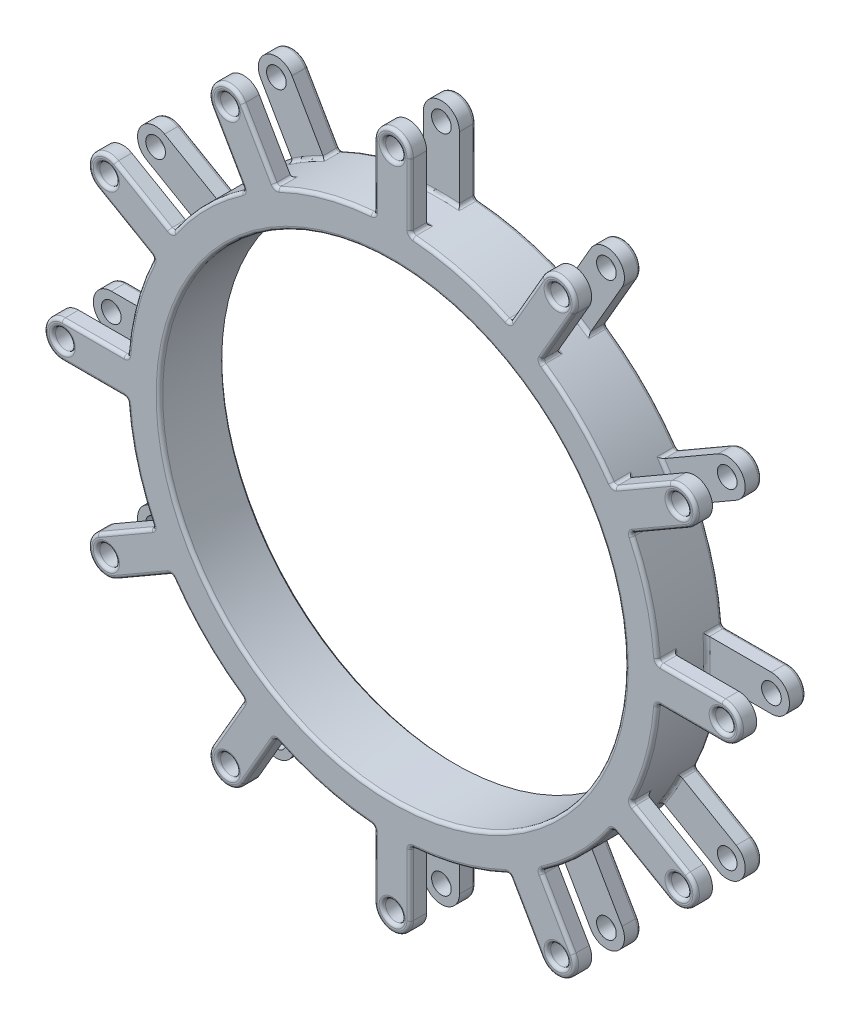
from build123d import *

# Parameters (mm, degrees)
ESQUISSE1_R                             = 40.5
ESQUISSE1_R_2                           = 35.5
BOSS_EXTRU_1_DEPTH                      = 10
ESQUISSE2_R                             = 1.5
BOSS_EXTRU_2_DEPTH                      = 2.5
CHANFREIN1_SIZE                         = 0.5
R_P_TITION_CIRCULAIRE2_COUNT            = 12
R_P_TITION_CIRCULAIRE2_COPY_1_SKETCH_R  = 1.5
R_P_TITION_CIRCULAIRE2_COPY_1_DEPTH     = 2.5
R_P_TITION_CIRCULAIRE2_COPY_2_SKETCH_R  = 1.5
R_P_TITION_CIRCULAIRE2_COPY_2_DEPTH     = 2.5
R_P_TITION_CIRCULAIRE2_COPY_3_SKETCH_R  = 1.5
R_P_TITION_CIRCULAIRE2_COPY_3_DEPTH     = 2.5
R_P_TITION_CIRCULAIRE2_COPY_4_SKETCH_R  = 1.5
R_P_TITION_CIRCULAIRE2_COPY_4_DEPTH     = 2.5
R_P_TITION_CIRCULAIRE2_COPY_5_SKETCH_R  = 1.5
R_P_TITION_CIRCULAIRE2_COPY_5_DEPTH     = 2.5
R_P_TITION_CIRCULAIRE2_COPY_6_SKETCH_R  = 1.5
R_P_TITION_CIRCULAIRE2_COPY_6_DEPTH     = 2.5
R_P_TITION_CIRCULAIRE2_COPY_7_SKETCH_R  = 1.5
R_P_TITION_CIRCULAIRE2_COPY_7_DEPTH     = 2.5
R_P_TITION_CIRCULAIRE2_COPY_8_SKETCH_R  = 1.5
R_P_TITION_CIRCULAIRE2_COPY_8_DEPTH     = 2.5
R_P_TITION_CIRCULAIRE2_COPY_9_SKETCH_R  = 1.5
R_P_TITION_CIRCULAIRE2_COPY_9_DEPTH     = 2.5
R_P_TITION_CIRCULAIRE2_COPY_10_SKETCH_R = 1.5
R_P_TITION_CIRCULAIRE2_COPY_10_DEPTH    = 2.5
R_P_TITION_CIRCULAIRE2_COPY_11_SKETCH_R = 1.5
R_P_TITION_CIRCULAIRE2_COPY_11_DEPTH    = 2.5
CONG_2_R                                = 0.5


with BuildPart() as part:
    # Esquisse1 → Boss.-Extru.1 (new body)
    with BuildSketch(Plane.XY):
        Circle(ESQUISSE1_R)
        Circle(ESQUISSE1_R_2, mode=Mode.SUBTRACT)
    extrude(amount=BOSS_EXTRU_1_DEPTH)

    # Esquisse2 → Boss.-Extru.2 (add)
    with BuildSketch(Plane(origin=(0, 0, 0), x_dir=(-1, 0, 0), z_dir=(0, 0, -1))):
        with BuildLine():
            ThreePointArc((-40.406527938, -2.75), (-40.5, 0), (-40.406527938, 2.75))
            Line((-40.406527938, 2.75), (-50.325274426, 2.75))
            ThreePointArc((-50.325274426, 2.75), (-53.075274426, 0), (-50.325274426, -2.75))
            Line((-50.325274426, -2.75), (-40.406527938, -2.75))
        make_face()
        with Locations((-50.325274426, 0)):
            Circle(ESQUISSE2_R, mode=Mode.SUBTRACT)
    boss_extru_2 = extrude(amount=-BOSS_EXTRU_2_DEPTH)

    # Symétrie1: Boss.-Extru.2 across plane
    add(boss_extru_2.mirror(Plane(origin=(0, 0, 5), x_dir=(1, 0, 0), z_dir=(0, 0, -1))))

    # Chanfrein1
    chanfrein1_edges = [part.edges().sort_by_distance(p)[0] for p in [
        (-35.5, 0, 0),
    ]]
    chamfer(chanfrein1_edges, length=CHANFREIN1_SIZE)

    # Répétition circulaire2: Boss.-Extru.2 ×12 about axis
    r_p_tition_circulaire2_axis = Axis((0, 0, 0), (0, 0, 1))
    for i in range(1, R_P_TITION_CIRCULAIRE2_COUNT):
        add(boss_extru_2.rotate(r_p_tition_circulaire2_axis, i * 360 / R_P_TITION_CIRCULAIRE2_COUNT))

    # Répétition circulaire2 copy 1 sketch → Répétition circulaire2 copy 1 (add)
    with BuildSketch(Plane(origin=(0, 0, 10), x_dir=(-0.8660254037844387, -0.49999999999999994, 0), z_dir=(0, 0, 1))):
        with BuildLine():
            ThreePointArc((-40.406527938, 2.75), (-40.5, 0), (-40.406527938, -2.75))
            Line((-40.406527938, -2.75), (-50.325274426, -2.75))
            ThreePointArc((-50.325274426, -2.75), (-53.075274426, 0), (-50.325274426, 2.75))
            Line((-50.325274426, 2.75), (-40.406527938, 2.75))
        make_face()
        with Locations((-50.325274426, 0)):
            Circle(R_P_TITION_CIRCULAIRE2_COPY_1_SKETCH_R, mode=Mode.SUBTRACT)
    extrude(amount=-R_P_TITION_CIRCULAIRE2_COPY_1_DEPTH)

    # Répétition circulaire2 copy 2 sketch → Répétition circulaire2 copy 2 (add)
    with BuildSketch(Plane(origin=(0, 0, 10), x_dir=(-0.5000000000000001, -0.8660254037844386, 0), z_dir=(0, 0, 1))):
        with BuildLine():
            ThreePointArc((-40.406527938, 2.75), (-40.5, 0), (-40.406527938, -2.75))
            Line((-40.406527938, -2.75), (-50.325274426, -2.75))
            ThreePointArc((-50.325274426, -2.75), (-53.075274426, 0), (-50.325274426, 2.75))
            Line((-50.325274426, 2.75), (-40.406527938, 2.75))
        make_face()
        with Locations((-50.325274426, 0)):
            Circle(R_P_TITION_CIRCULAIRE2_COPY_2_SKETCH_R, mode=Mode.SUBTRACT)
    extrude(amount=-R_P_TITION_CIRCULAIRE2_COPY_2_DEPTH)

    # Répétition circulaire2 copy 3 sketch → Répétition circulaire2 copy 3 (add)
    with BuildSketch(Plane(origin=(0, 0, 10), x_dir=(0, -1, 0), z_dir=(0, 0, 1))):
        with BuildLine():
            ThreePointArc((-40.406527938, 2.75), (-40.5, 0), (-40.406527938, -2.75))
            Line((-40.406527938, -2.75), (-50.325274426, -2.75))
            ThreePointArc((-50.325274426, -2.75), (-53.075274426, 0), (-50.325274426, 2.75))
            Line((-50.325274426, 2.75), (-40.406527938, 2.75))
        make_face()
        with Locations((-50.325274426, 0)):
            Circle(R_P_TITION_CIRCULAIRE2_COPY_3_SKETCH_R, mode=Mode.SUBTRACT)
    extrude(amount=-R_P_TITION_CIRCULAIRE2_COPY_3_DEPTH)

    # Répétition circulaire2 copy 4 sketch → Répétition circulaire2 copy 4 (add)
    with BuildSketch(Plane(origin=(0, 0, 10), x_dir=(0.4999999999999998, -0.8660254037844387, 0), z_dir=(0, 0, 1))):
        with BuildLine():
            ThreePointArc((-40.406527938, 2.75), (-40.5, 0), (-40.406527938, -2.75))
            Line((-40.406527938, -2.75), (-50.325274426, -2.75))
            ThreePointArc((-50.325274426, -2.75), (-53.075274426, 0), (-50.325274426, 2.75))
            Line((-50.325274426, 2.75), (-40.406527938, 2.75))
        make_face()
        with Locations((-50.325274426, 0)):
            Circle(R_P_TITION_CIRCULAIRE2_COPY_4_SKETCH_R, mode=Mode.SUBTRACT)
    extrude(amount=-R_P_TITION_CIRCULAIRE2_COPY_4_DEPTH)

    # Répétition circulaire2 copy 5 sketch → Répétition circulaire2 copy 5 (add)
    with BuildSketch(Plane(origin=(0, 0, 10), x_dir=(0.8660254037844387, -0.49999999999999994, 0), z_dir=(0, 0, 1))):
        with BuildLine():
            ThreePointArc((-40.406527938, 2.75), (-40.5, 0), (-40.406527938, -2.75))
            Line((-40.406527938, -2.75), (-50.325274426, -2.75))
            ThreePointArc((-50.325274426, -2.75), (-53.075274426, 0), (-50.325274426, 2.75))
            Line((-50.325274426, 2.75), (-40.406527938, 2.75))
        make_face()
        with Locations((-50.325274426, 0)):
            Circle(R_P_TITION_CIRCULAIRE2_COPY_5_SKETCH_R, mode=Mode.SUBTRACT)
    extrude(amount=-R_P_TITION_CIRCULAIRE2_COPY_5_DEPTH)

    # Répétition circulaire2 copy 6 sketch → Répétition circulaire2 copy 6 (add)
    with BuildSketch(Plane.XY.offset(10)):
        with BuildLine():
            ThreePointArc((-40.406527938, 2.75), (-40.5, 0), (-40.406527938, -2.75))
            Line((-40.406527938, -2.75), (-50.325274426, -2.75))
            ThreePointArc((-50.325274426, -2.75), (-53.075274426, 0), (-50.325274426, 2.75))
            Line((-50.325274426, 2.75), (-40.406527938, 2.75))
        make_face()
        with Locations((-50.325274426, 0)):
            Circle(R_P_TITION_CIRCULAIRE2_COPY_6_SKETCH_R, mode=Mode.SUBTRACT)
    extrude(amount=-R_P_TITION_CIRCULAIRE2_COPY_6_DEPTH)

    # Répétition circulaire2 copy 7 sketch → Répétition circulaire2 copy 7 (add)
    with BuildSketch(Plane(origin=(0, 0, 10), x_dir=(0.8660254037844386, 0.5000000000000001, 0), z_dir=(0, 0, 1))):
        with BuildLine():
            ThreePointArc((-40.406527938, 2.75), (-40.5, 0), (-40.406527938, -2.75))
            Line((-40.406527938, -2.75), (-50.325274426, -2.75))
            ThreePointArc((-50.325274426, -2.75), (-53.075274426, 0), (-50.325274426, 2.75))
            Line((-50.325274426, 2.75), (-40.406527938, 2.75))
        make_face()
        with Locations((-50.325274426, 0)):
            Circle(R_P_TITION_CIRCULAIRE2_COPY_7_SKETCH_R, mode=Mode.SUBTRACT)
    extrude(amount=-R_P_TITION_CIRCULAIRE2_COPY_7_DEPTH)

    # Répétition circulaire2 copy 8 sketch → Répétition circulaire2 copy 8 (add)
    with BuildSketch(Plane(origin=(0, 0, 10), x_dir=(0.5000000000000004, 0.8660254037844384, 0), z_dir=(0, 0, 1))):
        with BuildLine():
            ThreePointArc((-40.406527938, 2.75), (-40.5, 0), (-40.406527938, -2.75))
            Line((-40.406527938, -2.75), (-50.325274426, -2.75))
            ThreePointArc((-50.325274426, -2.75), (-53.075274426, 0), (-50.325274426, 2.75))
            Line((-50.325274426, 2.75), (-40.406527938, 2.75))
        make_face()
        with Locations((-50.325274426, 0)):
            Circle(R_P_TITION_CIRCULAIRE2_COPY_8_SKETCH_R, mode=Mode.SUBTRACT)
    extrude(amount=-R_P_TITION_CIRCULAIRE2_COPY_8_DEPTH)

    # Répétition circulaire2 copy 9 sketch → Répétition circulaire2 copy 9 (add)
    with BuildSketch(Plane(origin=(0, 0, 10), x_dir=(0, 1, 0), z_dir=(0, 0, 1))):
        with BuildLine():
            ThreePointArc((-40.406527938, 2.75), (-40.5, 0), (-40.406527938, -2.75))
            Line((-40.406527938, -2.75), (-50.325274426, -2.75))
            ThreePointArc((-50.325274426, -2.75), (-53.075274426, 0), (-50.325274426, 2.75))
            Line((-50.325274426, 2.75), (-40.406527938, 2.75))
        make_face()
        with Locations((-50.325274426, 0)):
            Circle(R_P_TITION_CIRCULAIRE2_COPY_9_SKETCH_R, mode=Mode.SUBTRACT)
    extrude(amount=-R_P_TITION_CIRCULAIRE2_COPY_9_DEPTH)

    # Répétition circulaire2 copy 10 sketch → Répétition circulaire2 copy 10 (add)
    with BuildSketch(Plane(origin=(0, 0, 10), x_dir=(-0.5000000000000001, 0.8660254037844386, 0), z_dir=(0, 0, 1))):
        with BuildLine():
            ThreePointArc((-40.406527938, 2.75), (-40.5, 0), (-40.406527938, -2.75))
            Line((-40.406527938, -2.75), (-50.325274426, -2.75))
            ThreePointArc((-50.325274426, -2.75), (-53.075274426, 0), (-50.325274426, 2.75))
            Line((-50.325274426, 2.75), (-40.406527938, 2.75))
        make_face()
        with Locations((-50.325274426, 0)):
            Circle(R_P_TITION_CIRCULAIRE2_COPY_10_SKETCH_R, mode=Mode.SUBTRACT)
    extrude(amount=-R_P_TITION_CIRCULAIRE2_COPY_10_DEPTH)

    # Répétition circulaire2 copy 11 sketch → Répétition circulaire2 copy 11 (add)
    with BuildSketch(Plane(origin=(0, 0, 10), x_dir=(-0.8660254037844384, 0.5000000000000004, 0), z_dir=(0, 0, 1))):
        with BuildLine():
            ThreePointArc((-40.406527938, 2.75), (-40.5, 0), (-40.406527938, -2.75))
            Line((-40.406527938, -2.75), (-50.325274426, -2.75))
            ThreePointArc((-50.325274426, -2.75), (-53.075274426, 0), (-50.325274426, 2.75))
            Line((-50.325274426, 2.75), (-40.406527938, 2.75))
        make_face()
        with Locations((-50.325274426, 0)):
            Circle(R_P_TITION_CIRCULAIRE2_COPY_11_SKETCH_R, mode=Mode.SUBTRACT)
    extrude(amount=-R_P_TITION_CIRCULAIRE2_COPY_11_DEPTH)

    # Congé2
    cong_2_edges = [part.edges().sort_by_distance(p)[0] for p in [
        (-22.584833829, 33.618079673, 1.25),
        (-17.821694109, 36.368079673, 1.25),
        (-20.25, 35.074028853, 2.5),
        (-36.368079673, 17.821694109, 1.25),
        (-33.618079673, 22.584833829, 1.25),
        (-35.074028853, 20.25, 2.5),
        (40.406527938, 2.75, 1.25),
        (40.406527938, -2.75, 1.25),
        (-40.406527938, -2.75, 1.25),
        (-40.406527938, 2.75, 1.25),
        (-40.5, 0, 2.5),
        (40.476625239, -1.375794046, 2.5),
        (-33.618079673, -22.584833829, 1.25),
        (-36.368079673, -17.821694109, 1.25),
        (-35.074028853, -20.25, 2.5),
        (-17.821694109, -36.368079673, 1.25),
        (-22.584833829, -33.618079673, 1.25),
        (-20.25, -35.074028853, 2.5),
        (2.75, -40.406527938, 1.25),
        (-2.75, -40.406527938, 1.25),
        (0, -40.5, 2.5),
        (22.584833829, -33.618079673, 1.25),
        (17.821694109, -36.368079673, 1.25),
        (20.25, -35.074028853, 2.5),
        (36.368079673, -17.821694109, 1.25),
        (33.618079673, -22.584833829, 1.25),
        (35.074028853, -20.25, 2.5),
        (35.074028853, 20.25, 7.5),
        (36.368079673, 17.821694109, 8.75),
        (33.618079673, 22.584833829, 8.75),
        (20.25, 35.074028853, 7.5),
        (22.584833829, 33.618079673, 8.75),
        (17.821694109, 36.368079673, 8.75),
        (0, 40.5, 7.5),
        (2.75, 40.406527938, 8.75),
        (-2.75, 40.406527938, 8.75),
        (-20.25, 35.074028853, 7.5),
        (-17.821694109, 36.368079673, 8.75),
        (-22.584833829, 33.618079673, 8.75),
        (40.476625239, -1.375794046, 7.5),
        (-35.074028853, 20.25, 7.5),
        (-33.618079673, 22.584833829, 8.75),
        (40.406527938, -2.75, 8.75),
        (-36.368079673, 17.821694109, 8.75),
        (40.406527938, 2.75, 8.75),
        (-40.5, 0, 7.5),
        (-40.406527938, 2.75, 8.75),
        (-40.406527938, -2.75, 8.75),
        (-35.074028853, -20.25, 7.5),
        (-36.368079673, -17.821694109, 8.75),
        (-33.618079673, -22.584833829, 8.75),
        (-20.25, -35.074028853, 7.5),
        (-22.584833829, -33.618079673, 8.75),
        (-17.821694109, -36.368079673, 8.75),
        (0, -40.5, 7.5),
        (-2.75, -40.406527938, 8.75),
        (2.75, -40.406527938, 8.75),
        (20.25, -35.074028853, 7.5),
        (17.821694109, -36.368079673, 8.75),
        (22.584833829, -33.618079673, 8.75),
        (35.074028853, -20.25, 7.5),
        (33.618079673, -22.584833829, 8.75),
        (36.368079673, -17.821694109, 8.75),
        (33.618079673, 22.584833829, 1.25),
        (36.368079673, 17.821694109, 1.25),
        (35.074028853, 20.25, 2.5),
        (17.821694109, 36.368079673, 1.25),
        (22.584833829, 33.618079673, 1.25),
        (20.25, 35.074028853, 2.5),
        (-2.75, 40.406527938, 1.25),
        (2.75, 40.406527938, 1.25),
        (0, 40.5, 2.5),
        (40.476625239, 1.375794046, 7.5),
        (40.476625239, 1.375794046, 2.5),
    ]]
    fillet(cong_2_edges, radius=CONG_2_R)
    cong_2_2_edges = [part.edges().sort_by_distance(p)[0] for p in [
        (-25.912637213, 44.882004211, 0),
        (-44.882004211, 25.912637213, 0),
        (51.825274426, 0, 0),
        (-51.825274426, 0, 0),
        (-44.882004211, -25.912637213, 0),
        (-25.912637213, -44.882004211, 0),
        (0, -51.825274426, 0),
        (25.912637213, -44.882004211, 0),
        (44.882004211, -25.912637213, 0),
        (44.882004211, 25.912637213, 10),
        (25.912637213, 44.882004211, 10),
        (0, 51.825274426, 10),
        (-25.912637213, 44.882004211, 10),
        (-44.882004211, 25.912637213, 10),
        (51.825274426, 0, 10),
        (-51.825274426, 0, 10),
        (-44.882004211, -25.912637213, 10),
        (-25.912637213, -44.882004211, 10),
        (0, -51.825274426, 10),
        (25.912637213, -44.882004211, 10),
        (44.882004211, -25.912637213, 10),
        (-36, 0, 0),
        (-35.5, 0, 10),
        (44.882004211, 25.912637213, 0),
        (25.912637213, 44.882004211, 0),
        (0, 51.825274426, 0),
    ]]
    fillet(cong_2_2_edges, radius=CONG_2_R)
    cong_2_3_edges = [part.edges().sort_by_distance(p)[0] for p in [
        (-28.637824638, 28.637824638, 0),
        (-26.537637213, 45.964535966, 0),
        (-20.417495256, 40.864139147, 0),
        (-25.180634977, 38.114139147, 0),
        (53.075274426, 0, 0),
        (-39.119995965, 10.482171327, 0),
        (-45.964535966, 26.537637213, 0),
        (-38.114139147, 25.180634977, 0),
        (-40.864139147, 20.417495256, 0),
        (45.598130234, -2.75, 0),
        (-39.119995965, -10.482171327, 0),
        (-53.075274426, 0, 0),
        (-45.598130234, 2.75, 0),
        (-45.598130234, -2.75, 0),
        (45.598130234, 2.75, 0),
        (-28.637824638, -28.637824638, 0),
        (-45.964535966, -26.537637213, 0),
        (-40.864139147, -20.417495256, 0),
        (-38.114139147, -25.180634977, 0),
        (-10.482171327, -39.119995965, 0),
        (-26.537637213, -45.964535966, 0),
        (-25.180634977, -38.114139147, 0),
        (-20.417495256, -40.864139147, 0),
        (10.482171327, -39.119995965, 0),
        (0, -53.075274426, 0),
        (-2.75, -45.598130234, 0),
        (2.75, -45.598130234, 0),
        (39.119995965, 10.482171327, 0),
        (28.637824638, -28.637824638, 0),
        (26.537637213, -45.964535966, 0),
        (20.417495256, -40.864139147, 0),
        (25.180634977, -38.114139147, 0),
        (39.119995965, -10.482171327, 0),
        (45.964535966, -26.537637213, 0),
        (38.114139147, -25.180634977, 0),
        (40.864139147, -20.417495256, 0),
        (28.637824638, 28.637824638, 10),
        (38.114139147, 25.180634977, 10),
        (45.964535966, 26.537637213, 10),
        (40.864139147, 20.417495256, 10),
        (10.482171327, 39.119995965, 10),
        (20.417495256, 40.864139147, 10),
        (26.537637213, 45.964535966, 10),
        (25.180634977, 38.114139147, 10),
        (-10.482171327, 39.119995965, 10),
        (-2.75, 45.598130234, 10),
        (0, 53.075274426, 10),
        (2.75, 45.598130234, 10),
        (-28.637824638, 28.637824638, 10),
        (-25.180634977, 38.114139147, 10),
        (-26.537637213, 45.964535966, 10),
        (-20.417495256, 40.864139147, 10),
        (-39.119995965, 10.482171327, 10),
        (-40.864139147, 20.417495256, 10),
        (-45.964535966, 26.537637213, 10),
        (-38.114139147, 25.180634977, 10),
        (45.598130234, 2.75, 10),
        (-39.119995965, -10.482171327, 10),
        (53.075274426, 0, 10),
        (-45.598130234, -2.75, 10),
        (-53.075274426, 0, 10),
        (-45.598130234, 2.75, 10),
        (45.598130234, -2.75, 10),
        (-28.637824638, -28.637824638, 10),
        (-38.114139147, -25.180634977, 10),
        (-45.964535966, -26.537637213, 10),
        (-40.864139147, -20.417495256, 10),
        (-10.482171327, -39.119995965, 10),
        (-20.417495256, -40.864139147, 10),
        (-26.537637213, -45.964535966, 10),
        (-25.180634977, -38.114139147, 10),
        (10.482171327, -39.119995965, 10),
        (2.75, -45.598130234, 10),
        (0, -53.075274426, 10),
        (-2.75, -45.598130234, 10),
        (28.637824638, -28.637824638, 10),
        (25.180634977, -38.114139147, 10),
        (26.537637213, -45.964535966, 10),
        (20.417495256, -40.864139147, 10),
        (39.119995965, -10.482171327, 10),
        (40.864139147, -20.417495256, 10),
        (45.964535966, -26.537637213, 10),
        (38.114139147, -25.180634977, 10),
        (39.119995965, 10.482171327, 10),
        (28.637824638, 28.637824638, 0),
        (45.964535966, 26.537637213, 0),
        (40.864139147, 20.417495256, 0),
        (38.114139147, 25.180634977, 0),
        (10.482171327, 39.119995965, 0),
        (26.537637213, 45.964535966, 0),
        (25.180634977, 38.114139147, 0),
        (20.417495256, 40.864139147, 0),
        (-10.482171327, 39.119995965, 0),
        (0, 53.075274426, 0),
        (2.75, 45.598130234, 0),
        (-2.75, 45.598130234, 0),
        (-2.882701026, 40.531734714, 0),
        (2.882701026, 40.531734714, 0),
        (-17.769375037, 36.542862434, 0),
        (17.769375037, 36.542862434, 0),
        (22.762359677, 33.660161409, 0),
        (33.660161409, 22.762359677, 0),
        (36.542862434, 17.769375037, 0),
        (40.531734714, 2.882701026, 10),
        (36.542862434, 17.769375037, 10),
        (33.660161409, -22.762359677, 10),
        (36.542862434, -17.769375037, 10),
        (40.531734714, -2.882701026, 10),
        (17.769375037, -36.542862434, 10),
        (22.762359677, -33.660161409, 10),
        (-2.882701026, -40.531734714, 10),
        (2.882701026, -40.531734714, 10),
        (-22.762359677, -33.660161409, 10),
        (-17.769375037, -36.542862434, 10),
        (-36.542862434, -17.769375037, 10),
        (-33.660161409, -22.762359677, 10),
        (-40.531734714, 2.882701026, 10),
        (-40.531734714, -2.882701026, 10),
        (-33.660161409, 22.762359677, 10),
        (-36.542862434, 17.769375037, 10),
        (-17.769375037, 36.542862434, 10),
        (-22.762359677, 33.660161409, 10),
        (2.882701026, 40.531734714, 10),
        (-2.882701026, 40.531734714, 10),
        (22.762359677, 33.660161409, 10),
        (17.769375037, 36.542862434, 10),
        (33.660161409, 22.762359677, 10),
        (36.542862434, -17.769375037, 0),
        (33.660161409, -22.762359677, 0),
        (40.531734714, -2.882701026, 0),
        (22.762359677, -33.660161409, 0),
        (17.769375037, -36.542862434, 0),
        (40.531734714, 2.882701026, 0),
        (2.882701026, -40.531734714, 0),
        (-2.882701026, -40.531734714, 0),
        (-17.769375037, -36.542862434, 0),
        (-22.762359677, -33.660161409, 0),
        (-33.660161409, -22.762359677, 0),
        (-36.542862434, -17.769375037, 0),
        (-40.531734714, -2.882701026, 0),
        (-40.531734714, 2.882701026, 0),
        (-36.542862434, 17.769375037, 0),
        (-33.660161409, 22.762359677, 0),
        (-22.762359677, 33.660161409, 0),
    ]]
    fillet(cong_2_3_edges, radius=CONG_2_R)


solid = part.part
